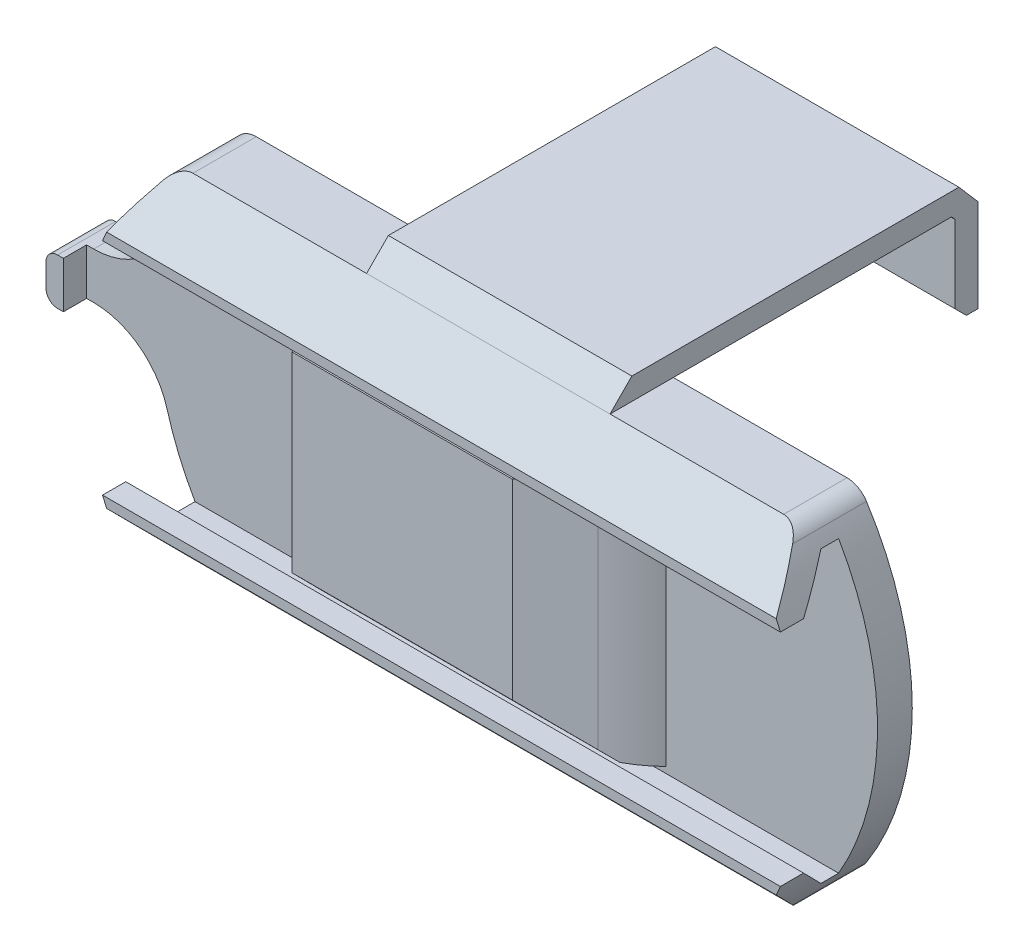
from build123d import *

# Parameters (mm, degrees)
BOSS_EXTRUDE1_DEPTH      = 3
CHAMFER1_SIZE            = 2.5
BOSS_EXTRUDE2_DEPTH      = 33
BOSS_EXTRUDE2_DEPTH_BACK = 35
SKETCH1_3_OUTSIDE_W      = 84.892
SKETCH1_3_OUTSIDE_H      = 45.692
CUT_EXTRUDE3_DEPTH       = 33
BOSS_EXTRUDE3_DEPTH      = 14
BOSS_EXTRUDE3_DEPTH_BACK = 14
CHAMFER3_SIZE            = 0.5
BOSS_EXTRUDE4_DEPTH      = 3
BOSS_EXTRUDE5_START      = -3
BOSS_EXTRUDE5_DEPTH      = 2
FILLET2_R                = 2
BOSS_EXTRUDE6_DEPTH      = 10.5
BOSS_EXTRUDE6_DEPTH_BACK = 10.5
SKETCH6_W                = 21
SKETCH6_H                = 1.835605581
CUT_EXTRUDE4_DEPTH       = 4
SKETCH7_W                = 20.6
SKETCH7_H                = 1.835605581
BOSS_EXTRUDE8_DEPTH      = 3.8
CHAMFER9_SIZE            = 0.5
CHAMFER10_SIZE           = 9
CHAMFER10_SIZE2          = 3.275732108
CHAMFER11_SIZE           = 1
CHAMFER12_SIZE           = 2
FILLET3_R                = 10


with BuildPart() as part:
    # Sketch1 → Boss-Extrude1 (new body)
    with BuildSketch(Plane.XY):
        with BuildLine():
            Line((-26.54, -14.4), (26.54, -14.4))
            ThreePointArc((26.54, -14.4), (31.11, 0), (26.54, 14.4))
            Line((26.54, 14.4), (-26.54, 14.4))
            ThreePointArc((-26.54, 14.4), (-31.11, 0), (-26.54, -14.4))
        make_face()
        with BuildLine():
            Line((-2.776416588, -7), (2.776416588, -7))
            ThreePointArc((2.776416588, -7), (6.470047841, -5.470047841), (8, -1.776416588))
            Line((8, -1.776416588), (8, 1.776416588))
            ThreePointArc((8, 1.776416588), (6.470047841, 5.470047841), (2.776416588, 7))
            Line((2.776416588, 7), (-2.776416588, 7))
            ThreePointArc((-2.776416588, 7), (-6.470047841, 5.470047841), (-8, 1.776416588))
            Line((-8, 1.776416588), (-8, -1.776416588))
            ThreePointArc((-8, -1.776416588), (-6.470047841, -5.470047841), (-2.776416588, -7))
        make_face(mode=Mode.SUBTRACT)
    extrude(amount=BOSS_EXTRUDE1_DEPTH)

    # Chamfer1
    chamfer1_edges = [part.edges().sort_by_distance(p)[0] for p in [
        (6.470047841, 5.470047841, 3),
        (0, 7, 3),
        (-6.470047841, 5.470047841, 3),
        (-8, 0, 3),
        (-6.470047841, -5.470047841, 3),
        (0, -7, 3),
        (6.470047841, -5.470047841, 3),
        (8, 0, 3),
    ]]
    chamfer(chamfer1_edges, length=CHAMFER1_SIZE)

    # Sketch2 → Boss-Extrude2 (add, two sides: drawn at the far end of the back side and taken through both)
    with BuildSketch(Plane(origin=(0, 0, 0), x_dir=(0, 0, -1), z_dir=(1, 0, 0)).offset(-BOSS_EXTRUDE2_DEPTH_BACK)):
        Polygon((-7.5, -9.5), (-4.526984069, -12.5), (-3, -12.5), (-3, -14.4), (-5.459809425, -14.4), (-9.5, -10.323139329), (-9.5, -9.5), align=None)
        Polygon((-5.459809425, 14.4), (-9.5, 10.323139329), (-9.5, 9.5), (-7.5, 9.5), (-4.526984069, 12.5), (-3, 12.5), (-3, 14.4), align=None)
    extrude(amount=BOSS_EXTRUDE2_DEPTH + BOSS_EXTRUDE2_DEPTH_BACK)

    # Sketch1<3> outside → Cut-Extrude3 (cut)
    # profile 1 of 2: a face of its own
    with BuildSketch(Plane.XY):
        with Locations((-1, 0)):
            Rectangle(SKETCH1_3_OUTSIDE_W, SKETCH1_3_OUTSIDE_H)
        with BuildLine():
            Line((-26.54, -14.4), (26.54, -14.4))
            ThreePointArc((26.54, -14.4), (31.11, 0), (26.54, 14.4))
            Line((26.54, 14.4), (-26.54, 14.4))
            ThreePointArc((-26.54, 14.4), (-31.11, 0), (-26.54, -14.4))
        make_face(mode=Mode.SUBTRACT)
    # profile 2 of 2: a face of its own
    with BuildSketch(Plane.XY):
        with BuildLine():
            Line((-2.776416588, -7), (2.776416588, -7))
            ThreePointArc((2.776416588, -7), (6.470047841, -5.470047841), (8, -1.776416588))
            Line((8, -1.776416588), (8, 1.776416588))
            ThreePointArc((8, 1.776416588), (6.470047841, 5.470047841), (2.776416588, 7))
            Line((2.776416588, 7), (-2.776416588, 7))
            ThreePointArc((-2.776416588, 7), (-6.470047841, 5.470047841), (-8, 1.776416588))
            Line((-8, 1.776416588), (-8, -1.776416588))
            ThreePointArc((-8, -1.776416588), (-6.470047841, -5.470047841), (-2.776416588, -7))
        make_face()
    extrude(amount=CUT_EXTRUDE3_DEPTH, mode=Mode.SUBTRACT)

    # Sketch4 → Boss-Extrude4 (add)
    with BuildSketch(Plane(origin=(0, 0, 0), x_dir=(-1, 0, 0), z_dir=(0, 0, -1))):
        with BuildLine():
            ThreePointArc((30.169832116, -6.787635659), (32.529805878, -3.331795741), (36.496999573, -2))
            Line((36.496999573, -2), (37.11, -2))
            Line((37.11, -2), (37.11, 2))
            Line((37.11, 2), (36.496999573, 2))
            ThreePointArc((36.496999573, 2), (32.529805878, 3.331795741), (30.169832116, 6.787635659))
            ThreePointArc((30.169832116, 6.787635659), (31.11, 0), (30.169832116, -6.787635659))
        make_face()
        with BuildLine():
            Line((37.11, 2), (37.11, -2))
            Line((37.11, -2), (37.61, -2))
            ThreePointArc((37.61, -2), (38.317106781, -1.707106781), (38.61, -1))
            Line((38.61, -1), (38.61, 1))
            ThreePointArc((38.61, 1), (38.317106781, 1.707106781), (37.61, 2))
            Line((37.61, 2), (37.11, 2))
        make_face()
    extrude(amount=-BOSS_EXTRUDE4_DEPTH)

    # Sketch4<3> → Boss-Extrude5 (add)
    with BuildSketch(Plane(origin=(0, 0, 0), x_dir=(-1, 0, 0), z_dir=(0, 0, -1)).offset(BOSS_EXTRUDE5_START)):
        with BuildLine():
            Line((37.11, 2), (37.11, -2))
            Line((37.11, -2), (37.61, -2))
            ThreePointArc((37.61, -2), (38.317106781, -1.707106781), (38.61, -1))
            Line((38.61, -1), (38.61, 1))
            ThreePointArc((38.61, 1), (38.317106781, 1.707106781), (37.61, 2))
            Line((37.61, 2), (37.11, 2))
        make_face()
    extrude(amount=-BOSS_EXTRUDE5_DEPTH)

    # Fillet2
    fillet2_edges = [part.edges().sort_by_distance(p)[0] for p in [
        (-26.54, -14.4, 2.729904712),
        (-26.54, 14.4, 2.729904712),
        (26.54, 14.4, 2.729904712),
        (26.54, -14.4, 2.729904712),
    ]]
    fillet(fillet2_edges, radius=FILLET2_R)

    # Sketch6 → Cut-Extrude4 (cut)
    with BuildSketch(Plane(origin=(0, 14.4, 0), x_dir=(1, 0, 0), z_dir=(0, 1, 0))):
        with Locations((0, -0.917802791)):
            Rectangle(SKETCH6_W, SKETCH6_H)
    extrude(amount=-CUT_EXTRUDE4_DEPTH, mode=Mode.SUBTRACT)


with BuildPart() as body_2:
    # Sketch3 → Boss-Extrude3 (new, two sides: drawn at the far end of the back side and taken through both)
    with BuildSketch(Plane(origin=(0, 0, 0), x_dir=(0, 0, -1), z_dir=(1, 0, 0)).offset(-BOSS_EXTRUDE3_DEPTH_BACK)):
        Polygon((-3.15, 11.511301569), (-3.15, -10.829758909), (-5.830234929, -10.829758909), (-8.385318876, -8.251484181), (-8.385318876, 8.251484181), (-5.154822534, 11.511301569), align=None)
    extrude(amount=BOSS_EXTRUDE3_DEPTH + BOSS_EXTRUDE3_DEPTH_BACK)

    # Chamfer3
    chamfer3_edges = [body_2.edges().sort_by_distance(p)[0] for p in [
        (0, 11.511301569, 3.15),
        (0, -10.829758909, 3.15),
    ]]
    chamfer(chamfer3_edges, length=CHAMFER3_SIZE)

    # Chamfer10
    chamfer10_edges = [body_2.edges().sort_by_distance(p)[0] for p in [
        (14, 0, 8.385318876),
    ]]
    chamfer10_side = [body_2.faces().sort_by_distance(p)[0] for p in [
        (0, 0, 8.385318876),
    ]]
    chamfer(chamfer10_edges, length=CHAMFER10_SIZE, length2=CHAMFER10_SIZE2, reference=chamfer10_side[0])

    # Chamfer11
    chamfer11_edges = [body_2.edges().sort_by_distance(p)[0] for p in [
        (14, 0.34077133, 3.15),
    ]]
    chamfer(chamfer11_edges, length=CHAMFER11_SIZE)

    # Chamfer12
    chamfer12_edges = [body_2.edges().sort_by_distance(p)[0] for p in [
        (-14, 0.34077133, 3.15),
    ]]
    chamfer(chamfer12_edges, length=CHAMFER12_SIZE)

    # Fillet3
    # the kernel refuses this fillet: 10 mm, written as the material it takes off along each edge
    with BuildSketch(Plane(origin=(14, -20.383884151, 5.109586768), x_dir=(0, 0, -1), z_dir=(0, 1, 0))) as fillet3_piece_1:
        with BuildLine():
            CenterArc((8.089844894, 7.011377828), FILLET3_R, 200, 24.518359904)
            Line((-1.307081314, 3.591176395), (-1.495019838, 3.522772366))
            Line((-1.495019838, 3.522772366), (-0.187938524, -0.068404029))
            Line((-0.187938524, -0.068404029), (0, -0.2))
            ThreePointArc((0, -0.2), (0.479793384, -0.2), (0.816981605, -0.140227557))
            Line((0.816981605, -0.140227557), (0.959586768, 0))
        make_face()
    extrude(amount=41.449310961, mode=Mode.SUBTRACT)


with BuildPart() as body_3:
    # Sketch5 → Boss-Extrude6 (new, two sides: drawn at the far end of the back side and taken through both)
    with BuildSketch(Plane(origin=(0, 0, 0), x_dir=(0, 0, -1), z_dir=(1, 0, 0)).offset(-BOSS_EXTRUDE6_DEPTH_BACK)):
        Polygon((0, 14.4), (24, 14.4), (24.278001924, 14.079736365), (24.278001924, 7.4), (25.278001924, 6.4), (26.278001924, 6.4), (26.278001924, 14.4), (24.630423167, 16.298042842), (-3.578838889, 16.298042842), (-5.459809425, 14.4), align=None)
    extrude(amount=BOSS_EXTRUDE6_DEPTH + BOSS_EXTRUDE6_DEPTH_BACK)

    # Sketch7 → Boss-Extrude8 (add)
    with BuildSketch(Plane(origin=(0, 14.4, 0), x_dir=(1, 0, 0), z_dir=(0, 1, 0))):
        with Locations((0, -0.917802791)):
            Rectangle(SKETCH7_W, SKETCH7_H)
    extrude(amount=-BOSS_EXTRUDE8_DEPTH)

    # Chamfer9
    chamfer9_edges = [body_3.edges().sort_by_distance(p)[0] for p in [
        (-10.3, 10.6, 0.91780279),
        (10.3, 10.6, 0.91780279),
    ]]
    chamfer(chamfer9_edges, length=CHAMFER9_SIZE)


solid = Compound([part.part, body_2.part, body_3.part])
